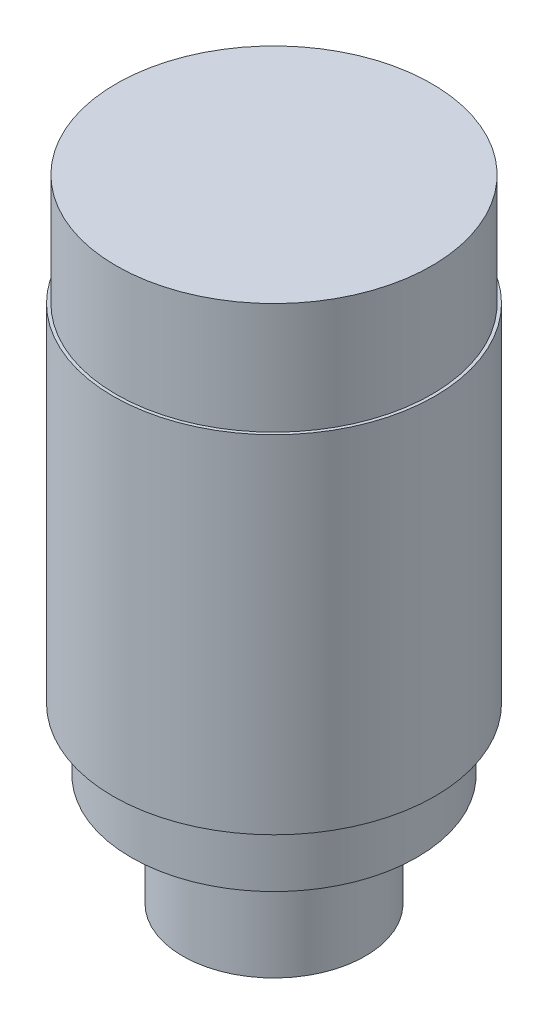
from build123d import *

# Parameters (mm, degrees)
SKETCH1_R           = 14.75
BOSS_EXTRUDE1_DEPTH = 18
SKETCH2_R           = 23.1
BOSS_EXTRUDE2_DEPTH = 10
SKETCH3_R           = 26
BOSS_EXTRUDE3_DEPTH = 74
CUT_EXTRUDE1_START  = -18
SKETCH4_R           = 26
SKETCH4_R_2         = 25.5
CUT_EXTRUDE1_DEPTH  = 18


with BuildPart() as part:
    # Sketch1 → Boss-Extrude1 (new body)
    with BuildSketch(Plane(origin=(0, 0, 0), x_dir=(1, 0, 0), z_dir=(0, 1, 0))):
        Circle(SKETCH1_R)
    extrude(amount=BOSS_EXTRUDE1_DEPTH)

    # Sketch2 → Boss-Extrude2 (add)
    with BuildSketch(Plane(origin=(0, 18, 0), x_dir=(1, 0, 0), z_dir=(0, 1, 0))):
        Circle(SKETCH2_R)
    extrude(amount=BOSS_EXTRUDE2_DEPTH)

    # Sketch3 → Boss-Extrude3 (add)
    with BuildSketch(Plane(origin=(0, 28, 0), x_dir=(1, 0, 0), z_dir=(0, 1, 0))):
        Circle(SKETCH3_R)
    extrude(amount=BOSS_EXTRUDE3_DEPTH)

    # Sketch4 → Cut-Extrude1 (cut)
    with BuildSketch(Plane(origin=(0, 102, 0), x_dir=(1, 0, 0), z_dir=(0, 1, 0)).offset(CUT_EXTRUDE1_START)):
        Circle(SKETCH4_R)
        Circle(SKETCH4_R_2, mode=Mode.SUBTRACT)
    extrude(amount=CUT_EXTRUDE1_DEPTH, mode=Mode.SUBTRACT)


solid = part.part
